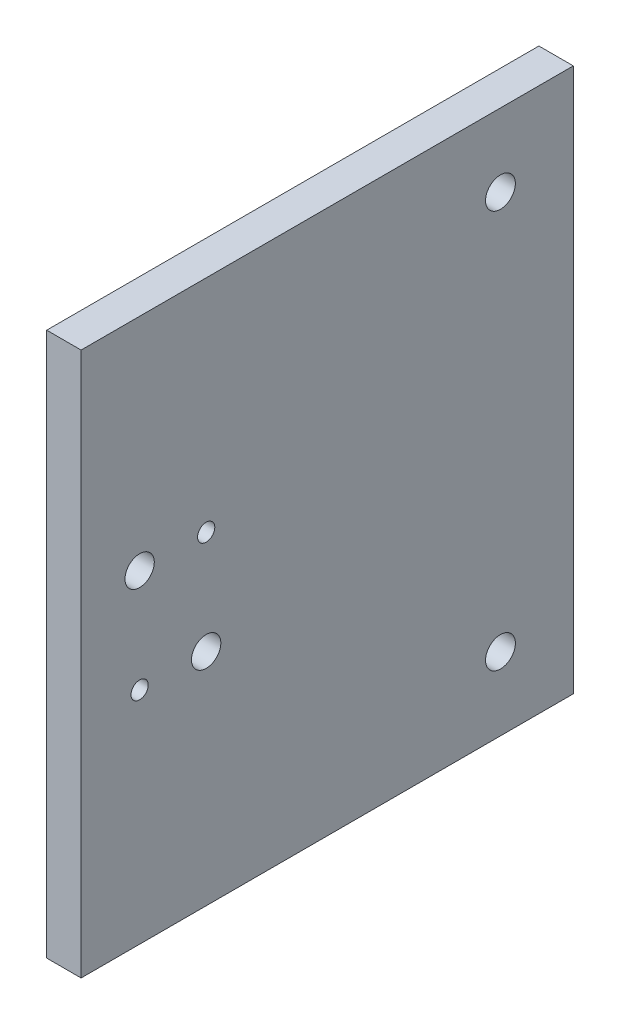
from build123d import *

# Parameters (mm, degrees)
SKETCH1_R           = 1.5
SKETCH1_R_2         = 2.555
SKETCH1_R_3         = 2.6
BOSS_EXTRUDE1_DEPTH = 6


with BuildPart() as part:
    # Sketch1 → Boss-Extrude1 (new body)
    with BuildSketch(Plane.YZ):
        Polygon((-47.4, -25), (-47.4, -69.8), (47.4, -69.8), (47.4, 16), (-47.4, 16), align=None)
        with Locations((-9, 5.8)):
            Circle(SKETCH1_R, mode=Mode.SUBTRACT)
        with Locations((-9, -5.8)):
            Circle(SKETCH1_R_2, mode=Mode.SUBTRACT)
        with Locations((9, -5.8)):
            Circle(SKETCH1_R, mode=Mode.SUBTRACT)
        with Locations((9, 5.8)):
            Circle(SKETCH1_R_2, mode=Mode.SUBTRACT)
        with Locations((-34.7, -57.1)):
            Circle(SKETCH1_R_3, mode=Mode.SUBTRACT)
        with Locations((34.7, -57.1)):
            Circle(SKETCH1_R_3, mode=Mode.SUBTRACT)
    extrude(amount=BOSS_EXTRUDE1_DEPTH)


solid = part.part
